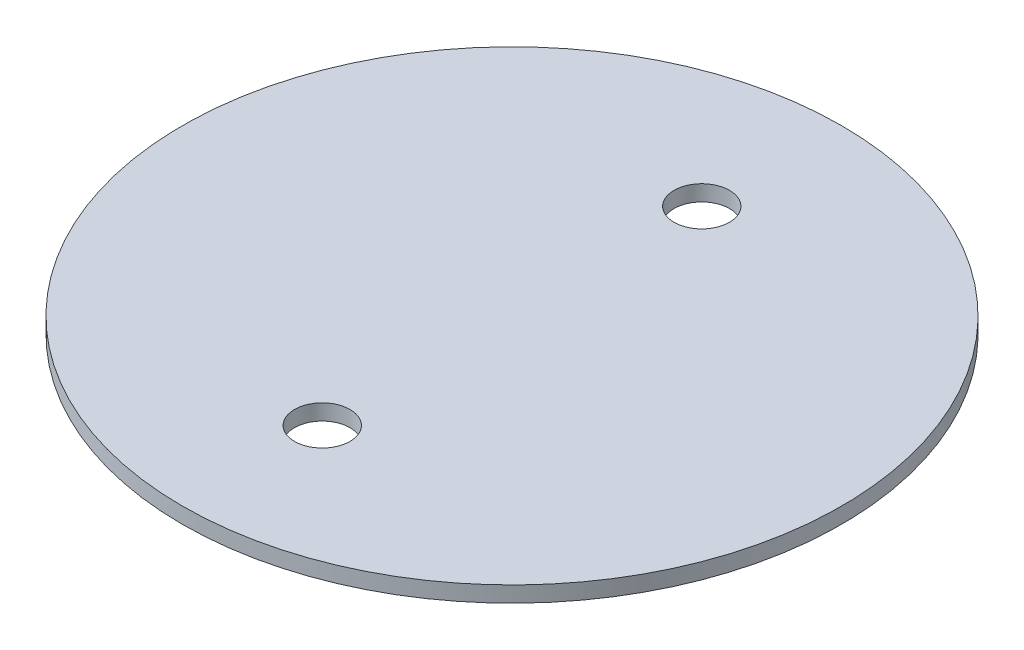
from build123d import *

# Parameters (mm, degrees)
SKETCH1_R           = 66.167
BOSS_EXTRUDE1_DEPTH = 3.175
SKETCH2_R           = 5.5626
CUT_EXTRUDE1_DEPTH  = 94.628117588


with BuildPart() as part:
    # Sketch1 → Boss-Extrude1 (new body)
    with BuildSketch(Plane(origin=(0, 0, 0), x_dir=(1, 0, 0), z_dir=(0, 1, 0))):
        Circle(SKETCH1_R)
    extrude(amount=BOSS_EXTRUDE1_DEPTH)

    # Sketch2 → Cut-Extrude1 (cut, through all)
    with BuildSketch(Plane.XZ):
        with Locations((0, -38.1)):
            Circle(SKETCH2_R)
        with Locations((0, 38.1)):
            Circle(SKETCH2_R)
    extrude(amount=-CUT_EXTRUDE1_DEPTH, mode=Mode.SUBTRACT)


solid = part.part
